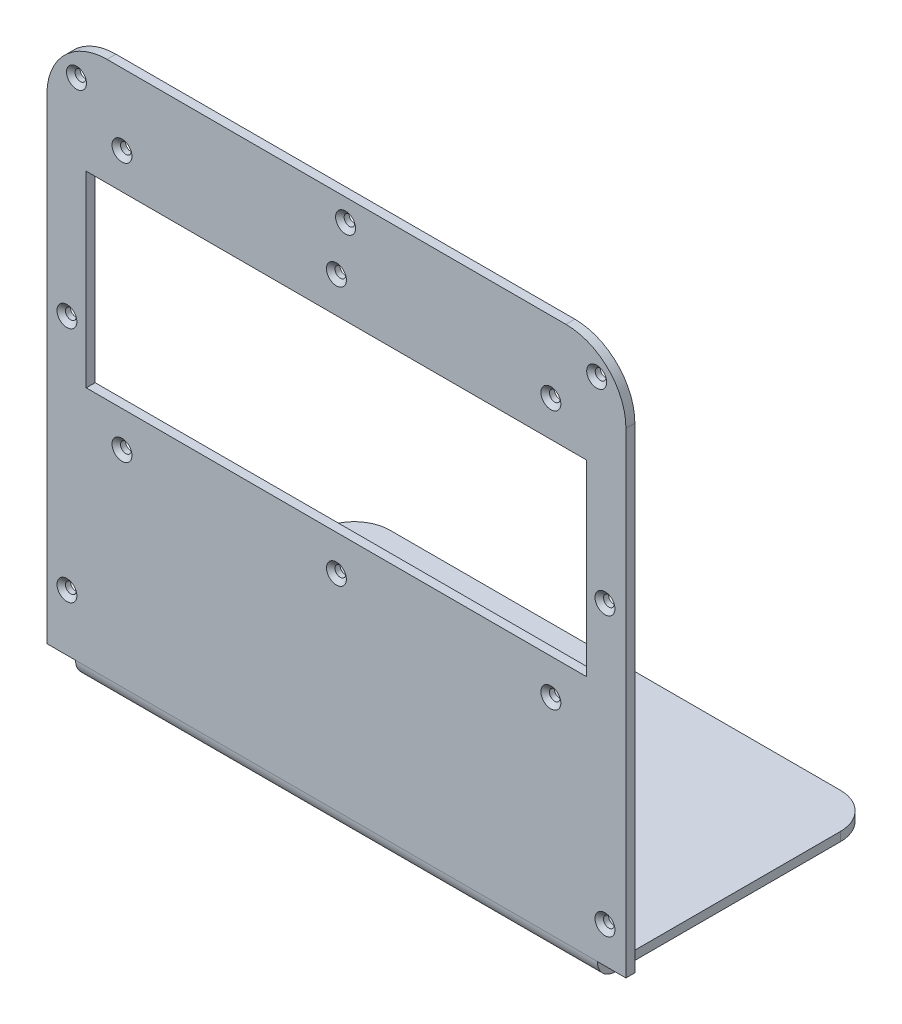
from build123d import *

# Parameters (mm, degrees)
BASE_FLANGE1_DEPTH                                = 102.87
SKETCH6_W                                         = 6.35
SKETCH6_H                                         = 99.06
CUT_EXTRUDE1_DEPTH                                = 10.16
FILLET1_R                                         = 21.336
FILLET2_R                                         = 12.7
SKETCH8_W                                         = 177.8
SKETCH8_H                                         = 66.675
CUT_EXTRUDE2_DEPTH                                = 10.16
CSK_FOR_6_FLAT_HEAD_MACHINE_SCREW_100_D           = 3.7973
CSK_FOR_6_FLAT_HEAD_MACHINE_SCREW_100_CSINK_D     = 7.0866
CSK_FOR_6_FLAT_HEAD_MACHINE_SCREW_100_CSINK_ANGLE = 100
CSK_FOR_6_FLAT_HEAD_MACHINE_SCREW_2_D             = 3.7973
CSK_FOR_6_FLAT_HEAD_MACHINE_SCREW_2_CSINK_D       = 7.0866
CSK_FOR_6_FLAT_HEAD_MACHINE_SCREW_2_CSINK_ANGLE   = 100


# Sheet-metal steps are written as plain solids
with BuildPart() as part:
    # Sketch1 → Base-Flange1 (new, symmetric)
    with BuildSketch(Plane.YZ):
        with BuildLine():
            Line((-25.4, -73.66), (-25.4, 19.05))
            ThreePointArc((-25.4, 19.05), (-23.540128061, 23.540128061), (-19.05, 25.4))
            Line((-19.05, 25.4), (171.45, 25.4))
            Line((171.45, 25.4), (171.45, 22.225))
            Line((171.45, 22.225), (-19.05, 22.225))
            ThreePointArc((-19.05, 22.225), (-21.29506403, 21.29506403), (-22.225, 19.05))
            Line((-22.225, 19.05), (-22.225, -73.66))
            Line((-22.225, -73.66), (-25.4, -73.66))
        make_face()
    extrude(amount=BASE_FLANGE1_DEPTH, both=True)

    # Sketch6 → Cut-Extrude1 (cut)
    with BuildSketch(Plane.YZ.offset(102.87)):
        with Locations((-22.225, -24.13)):
            Rectangle(SKETCH6_W, SKETCH6_H)
    cut_extrude1 = extrude(amount=-CUT_EXTRUDE1_DEPTH, mode=Mode.SUBTRACT)

    # Mirror1: Cut-Extrude1 across plane
    add(cut_extrude1.mirror(Plane(origin=(0, 0, 0), x_dir=(0, 0, 1), z_dir=(1, 0, 0))), mode=Mode.SUBTRACT)

    # Fillet1
    fillet1_edges = [part.edges().sort_by_distance(p)[0] for p in [
        (102.87, 171.45, 23.8125),
        (-102.87, 171.45, 23.8125),
    ]]
    fillet(fillet1_edges, radius=FILLET1_R)

    # Fillet2
    fillet2_edges = [part.edges().sort_by_distance(p)[0] for p in [
        (92.71, -23.8125, -73.66),
        (-92.71, -23.8125, -73.66),
    ]]
    fillet(fillet2_edges, radius=FILLET2_R)

    # Sketch8 → Cut-Extrude2 (cut)
    with BuildSketch(Plane.XY.offset(25.4)):
        with Locations((0, 100.0125)):
            Rectangle(SKETCH8_W, SKETCH8_H)
    extrude(amount=-CUT_EXTRUDE2_DEPTH, mode=Mode.SUBTRACT)

    # CSK for _6 Flat Head Machine Screw _100 (through all)
    with Locations(Plane.XY.offset(25.4)):
        with Locations((-76.2, 146.05), (0, 146.05), (76.2, 146.05), (76.2, 53.975), (0, 53.975), (-76.2, 53.975)):
            CounterSinkHole(CSK_FOR_6_FLAT_HEAD_MACHINE_SCREW_100_D / 2, CSK_FOR_6_FLAT_HEAD_MACHINE_SCREW_100_CSINK_D / 2, counter_sink_angle=CSK_FOR_6_FLAT_HEAD_MACHINE_SCREW_100_CSINK_ANGLE)

    # CSK for _6 Flat Head Machine Screw _ 2 (through all)
    with Locations(Plane.XY.offset(25.4)):
        with Locations((92.4814, 160.8074), (95.4278, 92.583), (95.4278, -6.223), (-95.758, 1.016), (-95.758, 85.344), (-92.3544, 160.401), (3.2512, 163.6268)):
            CounterSinkHole(CSK_FOR_6_FLAT_HEAD_MACHINE_SCREW_2_D / 2, CSK_FOR_6_FLAT_HEAD_MACHINE_SCREW_2_CSINK_D / 2, counter_sink_angle=CSK_FOR_6_FLAT_HEAD_MACHINE_SCREW_2_CSINK_ANGLE)


solid = part.part
